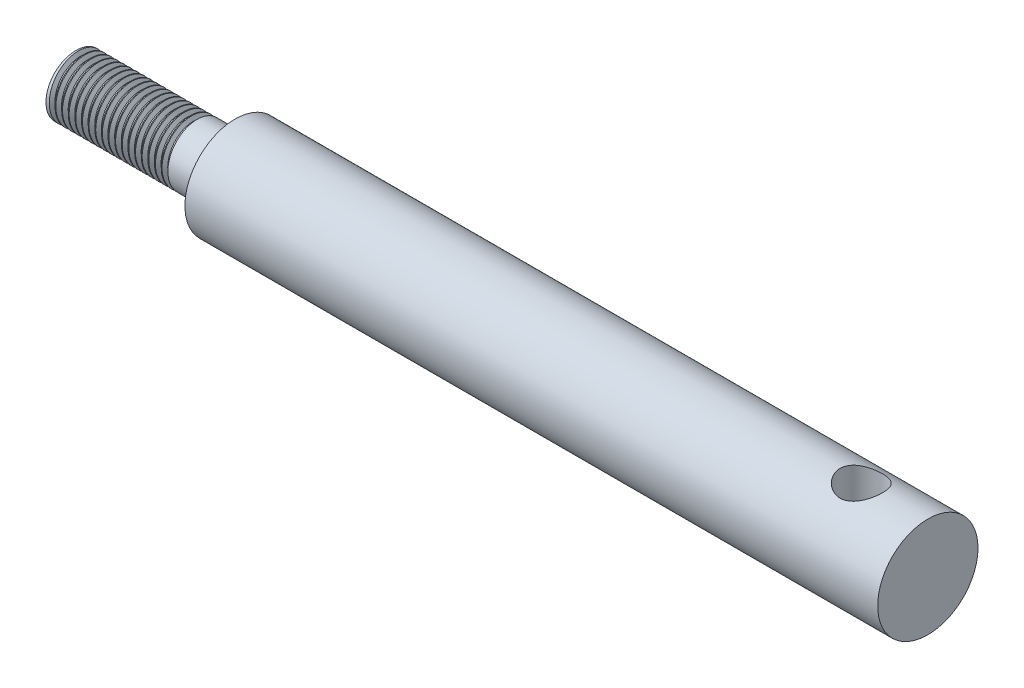
from build123d import *

# Parameters (mm, degrees)
SKETCH1_R                   = 8.001
BOSS_EXTRUDE1_DEPTH         = 110.49
SKETCH4_R                   = 4.7625
BOSS_EXTRUDE2_DEPTH         = 25.4
THREAD2_PITCH               = 1.058333333
F_1_4_CLEARANCE_HOLE1_D     = 6.7564
F_1_4_CLEARANCE_HOLE1_DEPTH = 22.352
F_1_4_CLEARANCE_HOLE1_TIP   = 2.029827343


with BuildPart() as part:
    # Sketch1 → Boss-Extrude1 (new body)
    with BuildSketch(Plane(origin=(0, 0, 0), x_dir=(0, 0, -1), z_dir=(1, 0, 0))):
        Circle(SKETCH1_R)
    extrude(amount=BOSS_EXTRUDE1_DEPTH)

    # Sketch4 → Boss-Extrude2 (add)
    with BuildSketch(Plane.ZY):
        Circle(SKETCH4_R)
    extrude(amount=BOSS_EXTRUDE2_DEPTH)

    # Thread2: the profile of Thread Profile2 profile screwed along a right-hand helix of 18 turns, 8 arcs to a turn; built about Z, then put on its axis
    thread2_z = Axis((0, 0, 0), (0, 0, 1))
    thread2_corners = [(4.7628, 0, -0.000173205), (4.7628, 0, 0.926214869), (4.189660282, 0, 0.595312499), (4.189660282, 0, 0.330729165)]
    with BuildLine(mode=Mode.PRIVATE) as thread2_profile:
        Line(thread2_corners[0], thread2_corners[1])
        Line(thread2_corners[1], thread2_corners[2])
        Line(thread2_corners[2], thread2_corners[3])
        Line(thread2_corners[3], thread2_corners[0])
    thread2_cap = Face(thread2_profile.wire())
    thread2_turn_angles = [0, 22.5, 45, 67.5, 90, 112.5, 135, 157.5, 180, 202.5, 225, 247.5, 270, 292.5, 315, 337.5, 360]
    thread2_turn_weights = [1, 0.9238795325112867, 1, 0.9238795325112867, 1, 0.9238795325112867, 1, 0.9238795325112867, 1, 0.9238795325112867, 1, 0.9238795325112867, 1, 0.9238795325112867, 1, 0.9238795325112867, 1]
    thread2_turn_rails = [Edge.make_bspline([Vector(p[0], p[1], 0).rotate(thread2_z, thread2_turn_angles[k]) / thread2_turn_weights[k] + Vector(0, 0, p[2] + THREAD2_PITCH * thread2_turn_angles[k] / 360) for k in range(17)], [0, 0, 0, 1, 1, 2, 2, 3, 3, 4, 4, 5, 5, 6, 6, 7, 7, 8, 8, 8], 2, thread2_turn_weights) for p in thread2_corners]
    thread2_turn_sides = [Face.make_surface_from_curves(thread2_turn_rails[p[0]], thread2_turn_rails[p[1]]) for p in [(0, 1), (1, 2), (2, 3), (3, 0)]]
    thread2 = Plane(origin=(-25.4, 0, 0), x_dir=(0, 0, -1), z_dir=(1, 0, 0)) * Solid(Shell([*[p.moved(Location((0, 0, THREAD2_PITCH * i))) for i in range(18) for p in thread2_turn_sides], thread2_cap, thread2_cap.rotate(thread2_z, 6480).moved(Location((0, 0, THREAD2_PITCH * 6480 / 360)))]))
    add(thread2, mode=Mode.SUBTRACT)

    # 1/4 Clearance Hole1
    with Locations(Plane(origin=(0, 8.001, 0), x_dir=(1, 0, 0), z_dir=(0, 1, 0))):
        with Locations((99.87788, 0)):
            Hole(F_1_4_CLEARANCE_HOLE1_D / 2, depth=F_1_4_CLEARANCE_HOLE1_DEPTH)
            with Locations((0, 0, -(F_1_4_CLEARANCE_HOLE1_DEPTH + F_1_4_CLEARANCE_HOLE1_TIP / 2))):  # 118° drill point
                Cone(0, F_1_4_CLEARANCE_HOLE1_D / 2, F_1_4_CLEARANCE_HOLE1_TIP, mode=Mode.SUBTRACT)


solid = part.part
